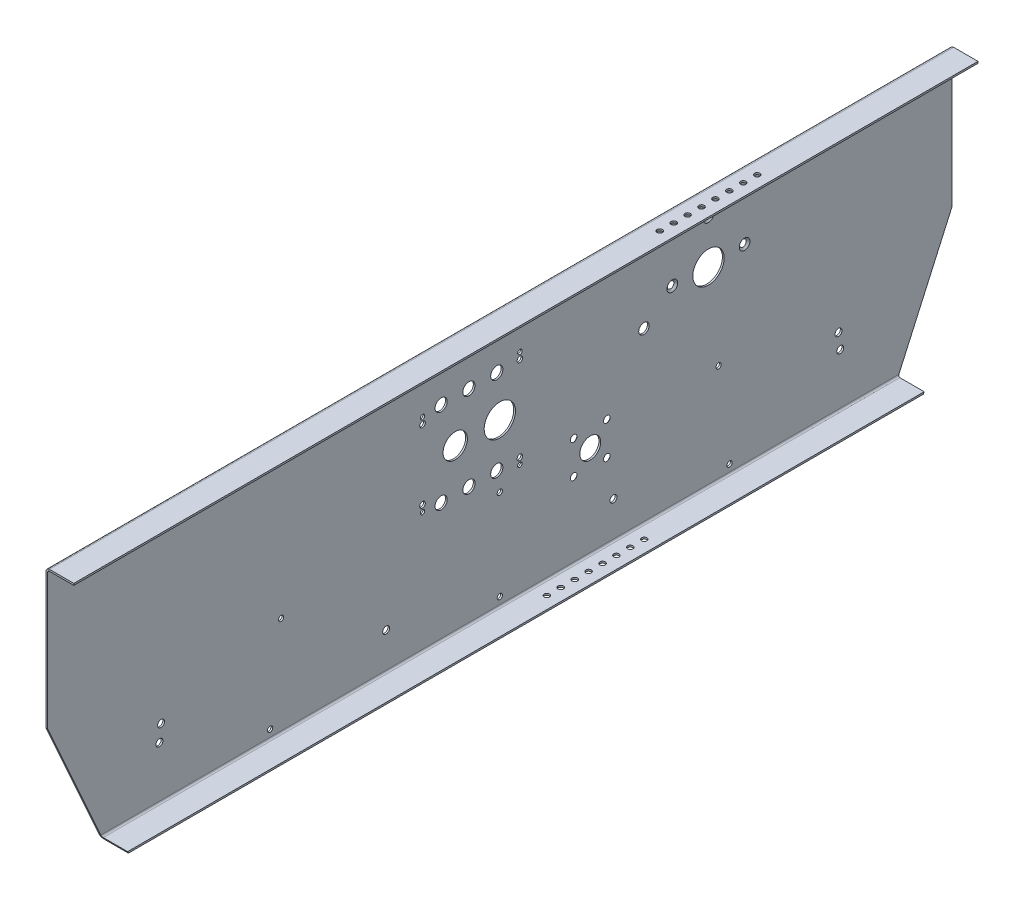
from build123d import *

# Parameters (mm, degrees)
BASE_FLANGE2_DEPTH                                 = 825.5
SKETCH1_R                                          = 3.175
SKETCH1_R_2                                        = 2.413
SKETCH1_R_3                                        = 5.55625
SKETCH1_R_4                                        = 2.5527
SKETCH1_R_5                                        = 2.0447
SKETCH1_R_6                                        = 14.28115
SKETCH1_R_7                                        = 11.10615
SKETCH1_R_8                                        = 1.5875
SKETCH1_R_9                                        = 9.525
SKETCH1_R_10                                       = 1.27
SKETCH1_R_11                                       = 14.2875
SKETCH1_R_12                                       = 4.7625
CUT_EXTRUDE3_DEPTH                                 = 859.694710551
CSK_FOR_10_FLAT_HEAD_MACHINE_SCREW_100_D           = 4.9784
CSK_FOR_10_FLAT_HEAD_MACHINE_SCREW_100_CSINK_D     = 9.779
CSK_FOR_10_FLAT_HEAD_MACHINE_SCREW_100_CSINK_ANGLE = 100
CSK_FOR_10_FLAT_HEAD_MACHINE_SCREW_2_AT_COUNT      = 2
CSK_FOR_10_FLAT_HEAD_MACHINE_SCREW_2_AT_PITCH      = 50.701163977
CSK_FOR_10_FLAT_HEAD_MACHINE_SCREW_3_COUNT         = 2
CSK_FOR_10_FLAT_HEAD_MACHINE_SCREW_3_PITCH         = 50.701163977
SKETCH10_R                                         = 0.635
CUT_EXTRUDE4_DEPTH                                 = 860.130662682
F_8_CLEARANCE_HOLE1_D                              = 4.9149
F_8_CLEARANCE_HOLE1_DEPTH                          = 1.5875
F_8_CLEARANCE_HOLE2_D                              = 4.9149
F_8_CLEARANCE_HOLE2_DEPTH                          = 1.5875


# Sheet-metal steps are written as plain solids
with BuildPart() as part:
    # Sketch3 → Base-Flange2 (new body)
    with BuildSketch(Plane.XY):
        with BuildLine():
            Line((3.175, 233.4895), (25.4, 233.4895))
            Line((25.4, 233.4895), (25.4, 235.077))
            Line((25.4, 235.077), (3.175, 235.077))
            ThreePointArc((3.175, 235.077), (0.92993597, 234.14706403), (0, 231.902))
            Line((0, 231.902), (0, 0))
            ThreePointArc((0, 0), (0.92993597, -2.24506403), (3.175, -3.175))
            Line((3.175, -3.175), (25.4, -3.175))
            Line((25.4, -3.175), (25.4, -1.5875))
            Line((25.4, -1.5875), (3.175, -1.5875))
            ThreePointArc((3.175, -1.5875), (2.052467985, -1.122532015), (1.5875, 0))
            Line((1.5875, 0), (1.5875, 231.902))
            ThreePointArc((1.5875, 231.902), (2.052467985, 233.024532015), (3.175, 233.4895))
        make_face()
    extrude(amount=-BASE_FLANGE2_DEPTH)

    # Sketch1 → Cut-Extrude3 (cut, through all)
    with BuildSketch(Plane(origin=(0, 0, 0), x_dir=(0, 0, -1), z_dir=(1, 0, 0))):
        with Locations(Location((516.509, 31.75, 0), (0, 0, 90))):
            Circle(SKETCH1_R)
        with Locations(Location((308.991, 31.75, 0), (0, 0, 90))):
            Circle(SKETCH1_R)
        with Locations(Location((103.492550911, 60.630923565, 0), (0, 0, 90))):
            Circle(SKETCH1_R)
        with Locations(Location((722.007449089, 60.630923565, 0), (0, 0, 90))):
            Circle(SKETCH1_R)
        with Locations(Location((412.75, 6.35, 0), (0, 0, 90))):
            Circle(SKETCH1_R_2)
        with Locations(Location((412.75, 88.9, 0), (0, 0, 90))):
            Circle(SKETCH1_R_2)
        with Locations(Location((622.478249316, 6.35, 0), (0, 0, 90))):
            Circle(SKETCH1_R_2)
        with Locations(Location((612.465522577, 88.9, 0), (0, 0, 90))):
            Circle(SKETCH1_R_2)
        with Locations(Location((203.021750684, 6.35, 0), (0, 0, 90))):
            Circle(SKETCH1_R_2)
        with Locations(Location((101.978503418, 46.225723918, 0), (0, 0, 90))):
            Circle(SKETCH1_R)
        with Locations(Location((723.521496582, 46.225723918, 0), (0, 0, 90))):
            Circle(SKETCH1_R)
        with Locations(Location((213.034477423, 88.9, 0), (0, 0, 90))):
            Circle(SKETCH1_R_2)
        with Locations(Location((359.180063087, 107.266959746, 0), (0, 0, 90))):
            Circle(SKETCH1_R_3)
        with Locations(Location((342.162063087, 114.251959746, 0), (0, 0, 90))):
            Circle(SKETCH1_R_4)
        with Locations(Location((342.162063087, 108.409959746, 0), (0, 0, 90))):
            Circle(SKETCH1_R_5)
        with Locations(Location((342.162063087, 177.751959746, 0), (0, 0, 90))):
            Circle(SKETCH1_R_4)
        with Locations(Location((342.162063087, 183.593959746, 0), (0, 0, 90))):
            Circle(SKETCH1_R_5)
        with Locations(Location((359.180063087, 184.736959746, 0), (0, 0, 90))):
            Circle(SKETCH1_R_3)
        with Locations(Location((384.580063087, 184.736959746, 0), (0, 0, 90))):
            Circle(SKETCH1_R_3)
        with Locations(Location((409.980063087, 184.736959746, 0), (0, 0, 90))):
            Circle(SKETCH1_R_3)
        with Locations(Location((431.062063087, 184.736959746, 0), (0, 0, 90))):
            Circle(SKETCH1_R_4)
        with Locations(Location((431.062063087, 190.578959746, 0), (0, 0, 90))):
            Circle(SKETCH1_R_5)
        with Locations(Location((431.062063087, 107.266959746, 0), (0, 0, 90))):
            Circle(SKETCH1_R_4)
        with Locations(Location((431.062063087, 101.424959746, 0), (0, 0, 90))):
            Circle(SKETCH1_R_5)
        with Locations(Location((412.75, 146.001959746, 0), (0, 0, 90))):
            Circle(SKETCH1_R_6)
        with Locations(Location((372.0338, 146.001959746, 0), (0, 0, 90))):
            Circle(SKETCH1_R_7)
        with Locations(Location((384.580063087, 107.266959746, 0), (0, 0, 90))):
            Circle(SKETCH1_R_3)
        with Locations(Location((409.980063087, 107.266959746, 0), (0, 0, 90))):
            Circle(SKETCH1_R_3)
        with Locations(Location((480.14255, 67.39255, 0), (0, 0, 90))):
            Circle(SKETCH1_R_8)
        with Locations(Location((510.45745, 67.39255, 0), (0, 0, 90))):
            Circle(SKETCH1_R_8)
        with Locations(Location((510.45745, 97.70745, 0), (0, 0, 90))):
            Circle(SKETCH1_R_8)
        with Locations(Location((480.14255, 97.70745, 0), (0, 0, 90))):
            Circle(SKETCH1_R_8)
        with Locations(Location((495.3, 82.55, 0), (0, 0, 90))):
            Circle(SKETCH1_R_9)
        with Locations(Location((636.250067105, 173.192896507, 0), (0, 0, 90))):
            Circle(SKETCH1_R_10)
        with Locations(Location((603.25, 171.694372229, 0), (0, 0, 90))):
            Circle(SKETCH1_R_11)
        with Locations(Location((570.249932895, 173.192896507, 0), (0, 0, 90))):
            Circle(SKETCH1_R_10)
        with Locations(Location((603.25, 211.684500783, 0), (0, 0, 90))):
            Circle(SKETCH1_R_10)
        with Locations(Location((544.318501255, 152.527, 0), (0, 0, 90))):
            Circle(SKETCH1_R_12)
        Polygon((825.5, -3.175), (775.673017562, -3.175), (825.5, 107.95), align=None)
        Polygon((0, 107.95), (49.826982438, -3.175), (0, -3.175), align=None)
    extrude(amount=CUT_EXTRUDE3_DEPTH, mode=Mode.SUBTRACT)

    # CSK for _10 Flat Head Machine Screw _100 (through all)
    with Locations(Plane.ZY):
        with Locations((-510.45745, 97.70745), (-480.14255, 97.70745), (-480.14255, 67.39255), (-510.45745, 67.39255)):
            CounterSinkHole(CSK_FOR_10_FLAT_HEAD_MACHINE_SCREW_100_D / 2, CSK_FOR_10_FLAT_HEAD_MACHINE_SCREW_100_CSINK_D / 2, counter_sink_angle=CSK_FOR_10_FLAT_HEAD_MACHINE_SCREW_100_CSINK_ANGLE)

    # Sketch8 → CSK for _10 Flat Head Machine Screw  2 (revolve, cut)
    with BuildSketch(Plane(origin=(1.5875, 211.684500783, -603.25), x_dir=(0, 0, -1), z_dir=(0, 1, 0))):
        Polygon((0, 0), (0, 1.5875), (2.4892, 1.5875), (2.4892, 2.014090845), (4.8895, 0), align=None)
    csk_for_10_flat_head_machine_screw_2 = revolve(axis=Axis((7.9375, 211.684500783, -603.25), (-1, 0, 0)), mode=Mode.SUBTRACT)

    # CSK for _10 Flat Head Machine Screw 2 at: CSK for _10 Flat Head Machine Screw  2 ×2
    with Locations(*[Vector(0, -0.7591858106628883, -0.6508739546856467) * (i * CSK_FOR_10_FLAT_HEAD_MACHINE_SCREW_2_AT_PITCH) for i in range(1, CSK_FOR_10_FLAT_HEAD_MACHINE_SCREW_2_AT_COUNT)]):
        add(csk_for_10_flat_head_machine_screw_2, mode=Mode.SUBTRACT)

    # CSK for _10 Flat Head Machine Screw  3: CSK for _10 Flat Head Machine Screw  2 ×2
    with Locations(*[Vector(0, -0.7591858106628849, 0.6508739546856506) * (i * CSK_FOR_10_FLAT_HEAD_MACHINE_SCREW_3_PITCH) for i in range(1, CSK_FOR_10_FLAT_HEAD_MACHINE_SCREW_3_COUNT)]):
        add(csk_for_10_flat_head_machine_screw_2, mode=Mode.SUBTRACT)

    # Sketch10 → Cut-Extrude4 (cut, through all)
    with BuildSketch(Plane(origin=(0, -1.5875, 0), x_dir=(1, 0, 0), z_dir=(0, 1, 0))):
        with Locations(Location((14.2875, 443.018983217, 0), (0, 0, 180))):
            Circle(SKETCH10_R)
        with Locations(Location((14.2875, 455.718983217, 0), (0, 0, 180))):
            Circle(SKETCH10_R)
        with Locations(Location((14.2875, 468.418983217, 0), (0, 0, 180))):
            Circle(SKETCH10_R)
        with Locations(Location((14.2875, 481.118983217, 0), (0, 0, 180))):
            Circle(SKETCH10_R)
        with Locations(Location((14.2875, 493.818983217, 0), (0, 0, 180))):
            Circle(SKETCH10_R)
        with Locations(Location((14.2875, 506.518983217, 0), (0, 0, 180))):
            Circle(SKETCH10_R)
        with Locations(Location((14.2875, 519.218983217, 0), (0, 0, 180))):
            Circle(SKETCH10_R)
        with Locations(Location((14.2875, 531.918983217, 0), (0, 0, 180))):
            Circle(SKETCH10_R)
    extrude(amount=-CUT_EXTRUDE4_DEPTH, mode=Mode.SUBTRACT)

    # #8 Clearance Hole1
    with Locations(Plane(origin=(0, -1.5875, 0), x_dir=(1, 0, 0), z_dir=(0, 1, 0))):
        with Locations((14.2875, 531.918983217), (14.2875, 519.218983217), (14.2875, 506.518983217), (14.2875, 493.818983217), (14.2875, 481.118983217), (14.2875, 468.418983217), (14.2875, 455.718983217), (14.2875, 443.018983217)):
            Hole(F_8_CLEARANCE_HOLE1_D / 2, depth=F_8_CLEARANCE_HOLE1_DEPTH)

    # #8 Clearance Hole2
    with Locations(Plane(origin=(0, 233.4895, 0), x_dir=(-1, 0, 0), z_dir=(0, -1, 0))):
        with Locations((-14.2875, 558.8), (-14.2875, 546.1), (-14.2875, 571.5), (-14.2875, 584.2), (-14.2875, 596.9), (-14.2875, 609.6), (-14.2875, 622.3), (-14.2875, 635)):
            Hole(F_8_CLEARANCE_HOLE2_D / 2, depth=F_8_CLEARANCE_HOLE2_DEPTH)


solid = part.part
